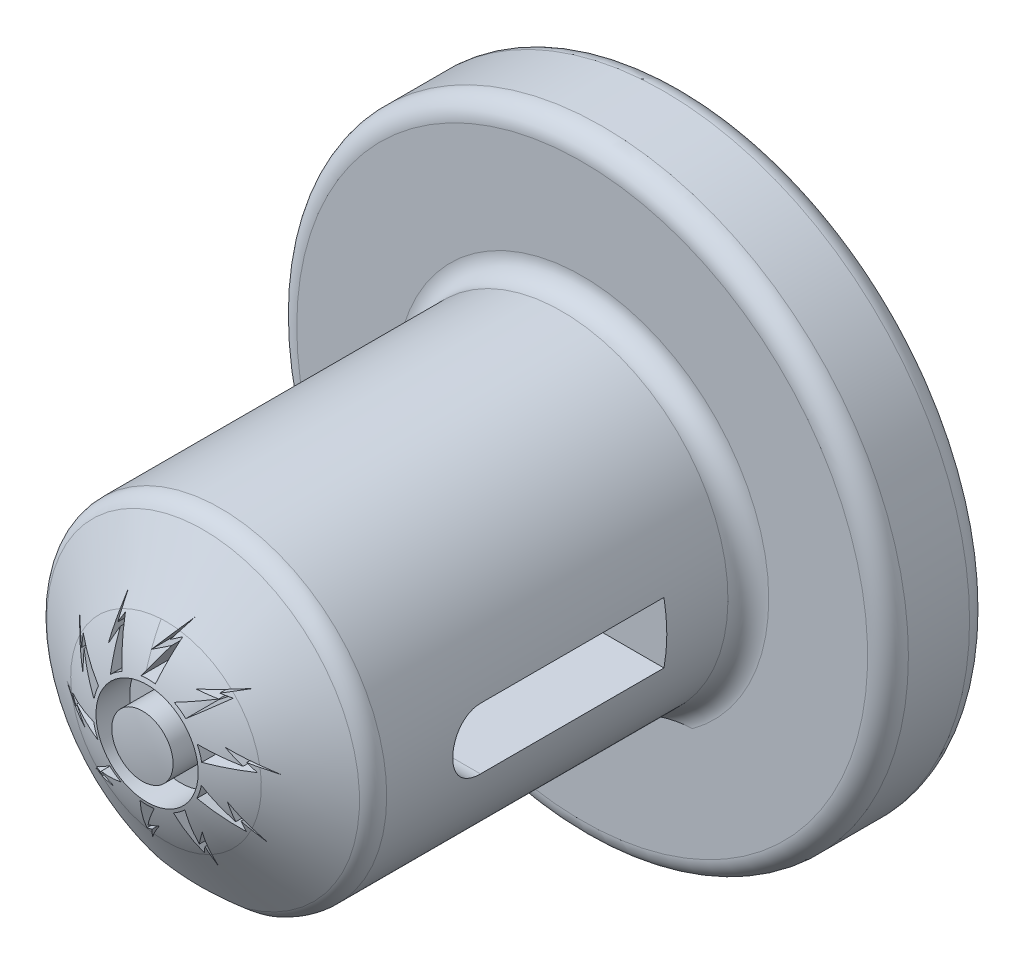
from build123d import *

# Parameters (mm, degrees)
SALIENTE_EXTRUIR1_DEPTH = 23.3
CROQUIS2_R              = 15
SALIENTE_EXTRUIR2_DEPTH = 5
CORTAR_EXTRUIR1_REACH   = 33.51
REDONDEO3_R             = 1
REDONDEO2_R             = 1
CROQUIS5_R              = 2.5
CROQUIS5_R_2            = 1.5
CORTAR_EXTRUIR2_DEPTH   = 2
CHAFL_N1_SIZE           = 0.5
CORTAR_EXTRUIR3_REACH   = 40.406


with BuildPart() as part:
    # Croquis1 → Saliente-Extruir1 (new body)
    with BuildSketch(Plane.XY):
        with BuildLine():
            Line((3.446313308, -7.38548743), (-3.446313308, -7.38548743))
            ThreePointArc((-3.446313308, -7.38548743), (0, 8.15), (3.446313308, -7.38548743))
        make_face()
        with BuildLine():
            Line((2.7, -4.38548743), (-2.7, -4.38548743))
            ThreePointArc((-2.7, -4.38548743), (0, 5.15), (2.7, -4.38548743))
        make_face(mode=Mode.SUBTRACT)
    extrude(amount=SALIENTE_EXTRUIR1_DEPTH)

    # Croquis2 → Saliente-Extruir2 (add)
    with BuildSketch(Plane(origin=(0, 0, 0), x_dir=(-1, 0, 0), z_dir=(0, 0, -1))):
        Circle(CROQUIS2_R)
        with BuildLine():
            Line((2.7, -4.38548743), (-2.7, -4.38548743))
            ThreePointArc((-2.7, -4.38548743), (0, 5.15), (2.7, -4.38548743))
        make_face(mode=Mode.SUBTRACT)
    extrude(amount=-SALIENTE_EXTRUIR2_DEPTH)

    # Croquis3 → Revolución1 (revolve)
    with BuildSketch(Plane(origin=(0, 0, 0), x_dir=(0, 0, -1), z_dir=(1, 0, 0))):
        with BuildLine():
            Line((-23.3, 0), (-23.3, 8.15))
            Line((-23.3, 8.15), (-25.412424531, 4.675672007))
            ThreePointArc((-25.412424531, 4.675672007), (-26.388642769, 2.427842124), (-26.72229506, 0))
            Line((-26.72229506, 0), (-23.3, 0))
        make_face()
    revolve(axis=Axis((0, 0, 26.72229506), (0, 0, -1)))

    # Croquis4 → Cortar-Extruir1 (cut, up to next)
    with BuildSketch(Plane(origin=(0, 0, 23.3), x_dir=(-1, 0, 0), z_dir=(0, 0, -1)), mode=Mode.PRIVATE) as cortar_extruir1_sk1:
        with BuildLine():
            Line((3.446313308, -7.38548743), (-3.446313308, -7.38548743))
            ThreePointArc((-3.446313308, -7.38548743), (0, -8.15), (3.446313308, -7.38548743))
        make_face()
    cortar_extruir1_tool1 = extrude(cortar_extruir1_sk1.sketch, amount=-CORTAR_EXTRUIR1_REACH, mode=Mode.PRIVATE) & part.part
    add(cortar_extruir1_tool1.solids().sort_by_distance((0, -7.692556, 23.3))[0], mode=Mode.SUBTRACT)

    # Redondeo3
    redondeo3_edges = [part.edges().sort_by_distance(p)[0] for p in [
        (15, 0, 0),
        (15, 0, 5),
        (0, 8.15, 5),
        (-7.956576605, 1.76504638, 23.3),
    ]]
    fillet(redondeo3_edges, radius=REDONDEO3_R)

    # Redondeo2
    redondeo2_edges = [part.edges().sort_by_distance(p)[0] for p in [
        (0, -4.38548743, 0),
        (0, 5.15, 0),
    ]]
    fillet(redondeo2_edges, radius=REDONDEO2_R)

    # Croquis5 → Cortar-Extruir2 (cut)
    # profile 1 of 11: a face of its own
    with BuildSketch(Plane.XY.offset(26.72229506)):
        with Locations((0.025979011, -0.015198441)):
            Circle(CROQUIS5_R)
        with Locations((0.025979011, -0.015198441)):
            Circle(CROQUIS5_R_2, mode=Mode.SUBTRACT)
    # profile 2 of 11: a face of its own
    with BuildSketch(Plane.XY.offset(26.72229506)):
        with BuildLine():
            Line((1.302557766, 2.344074393), (2.881616708, 2.973814702))
            Line((2.881616708, 2.973814702), (1.998734761, 3.074340177))
            Line((1.998734761, 3.074340177), (3.892874702, 3.589350961))
            Line((3.892874702, 3.589350961), (2.860263918, 3.177538192))
            Line((2.860263918, 3.177538192), (3.350806324, 3.121684736))
            Line((3.350806324, 3.121684736), (1.868869662, 1.932624716))
            ThreePointArc((1.868869662, 1.932624716), (1.599104223, 2.156780008), (1.302557766, 2.344074393))
        make_face()
    # profile 3 of 11: a face of its own
    with BuildSketch(Plane.XY.offset(26.72229506)):
        with BuildLine():
            Line((-0.324020989, 2.662020265), (0.583312464, 4.099638436))
            Line((0.583312464, 4.099638436), (-0.190041428, 3.662020265))
            Line((-0.190041428, 3.662020265), (1.039634231, 5.192020265))
            Line((1.039634231, 5.192020265), (0.44629203, 4.251903346))
            Line((0.44629203, 4.251903346), (0.875979011, 4.495050543))
            Line((0.875979011, 4.495050543), (0.375979011, 2.662020265))
            ThreePointArc((0.375979011, 2.662020265), (0.025979011, 2.684801559), (-0.324020989, 2.662020265))
        make_face()
    # profile 4 of 11: a face of its own
    with BuildSketch(Plane.XY.offset(26.72229506)):
        with BuildLine():
            Line((2.431603727, 1.130771774), (4.079241313, 0.712094828))
            Line((4.079241313, 0.712094828), (3.424062205, 1.312366634))
            Line((3.424062205, 1.312366634), (5.259169351, 0.615671587))
            Line((5.259169351, 0.615671587), (4.181712206, 0.889461449))
            Line((4.181712206, 0.889461449), (4.545739511, 0.555941462))
            Line((4.545739511, 0.555941462), (2.647915623, 0.465032213))
            ThreePointArc((2.647915623, 0.465032213), (2.561425973, 0.804941801), (2.431603727, 1.130771774))
        make_face()
    # profile 5 of 11: a face of its own
    with BuildSketch(Plane.XY.offset(26.72229506)):
        with BuildLine():
            Line((2.631859712, -0.514447228), (3.718734384, -1.821621067))
            Line((3.718734384, -1.821621067), (3.541514267, -0.950886357))
            Line((3.541514267, -0.950886357), (4.61664006, -2.593173407))
            Line((4.61664006, -2.593173407), (3.905888563, -1.738359335))
            Line((3.905888563, -1.738359335), (4.004354709, -2.222152555))
            Line((4.004354709, -2.222152555), (2.415547816, -1.180186789))
            ThreePointArc((2.415547816, -1.180186789), (2.545370062, -0.854356816), (2.631859712, -0.514447228))
        make_face()
    # profile 6 of 11: a face of its own
    with BuildSketch(Plane.XY.offset(26.72229506)):
        with BuildLine():
            Line((1.82683474, -1.963164875), (1.937797316, -3.659539629))
            Line((1.937797316, -3.659539629), (2.30622825, -2.85093308))
            Line((2.30622825, -2.85093308), (2.210711181, -4.811514298))
            Line((2.210711181, -4.811514298), (2.138148245, -3.702185939))
            Line((2.138148245, -3.702185939), (1.933442511, -4.151459824))
            Line((1.933442511, -4.151459824), (1.260522844, -2.374614551))
            ThreePointArc((1.260522844, -2.374614551), (1.5570693, -2.187320167), (1.82683474, -1.963164875))
        make_face()
    # profile 7 of 11: a face of its own
    with BuildSketch(Plane.XY.offset(26.72229506)):
        with BuildLine():
            Line((0.324020989, -2.662020265), (-0.583312464, -4.099638436))
            Line((-0.583312464, -4.099638436), (0.190041428, -3.662020265))
            Line((0.190041428, -3.662020265), (-1.039634231, -5.192020265))
            Line((-1.039634231, -5.192020265), (-0.44629203, -4.251903346))
            Line((-0.44629203, -4.251903346), (-0.875979011, -4.495050543))
            Line((-0.875979011, -4.495050543), (-0.375979011, -2.662020265))
            ThreePointArc((-0.375979011, -2.662020265), (-0.025979011, -2.684801559), (0.324020989, -2.662020265))
        make_face()
    # profile 8 of 11: a face of its own
    with BuildSketch(Plane.XY.offset(26.72229506)):
        with BuildLine():
            Line((-1.302557766, -2.344074393), (-2.881616708, -2.973814702))
            Line((-2.881616708, -2.973814702), (-1.998734761, -3.074340177))
            Line((-1.998734761, -3.074340177), (-3.892874702, -3.589350961))
            Line((-3.892874702, -3.589350961), (-2.860263918, -3.177538192))
            Line((-2.860263918, -3.177538192), (-3.350806324, -3.121684736))
            Line((-3.350806324, -3.121684736), (-1.868869662, -1.932624716))
            ThreePointArc((-1.868869662, -1.932624716), (-1.599104223, -2.156780008), (-1.302557766, -2.344074393))
        make_face()
    # profile 9 of 11: a face of its own
    with BuildSketch(Plane.XY.offset(26.72229506)):
        with BuildLine():
            Line((-2.431603727, -1.130771774), (-4.079241313, -0.712094828))
            Line((-4.079241313, -0.712094828), (-3.424062205, -1.312366634))
            Line((-3.424062205, -1.312366634), (-5.259169351, -0.615671587))
            Line((-5.259169351, -0.615671587), (-4.181712206, -0.889461449))
            Line((-4.181712206, -0.889461449), (-4.545739511, -0.555941462))
            Line((-4.545739511, -0.555941462), (-2.647915623, -0.465032213))
            ThreePointArc((-2.647915623, -0.465032213), (-2.561425973, -0.804941801), (-2.431603727, -1.130771774))
        make_face()
    # profile 10 of 11: a face of its own
    with BuildSketch(Plane.XY.offset(26.72229506)):
        with BuildLine():
            Line((-2.631859712, 0.514447228), (-3.718734384, 1.821621067))
            Line((-3.718734384, 1.821621067), (-3.541514267, 0.950886357))
            Line((-3.541514267, 0.950886357), (-4.61664006, 2.593173407))
            Line((-4.61664006, 2.593173407), (-3.905888563, 1.738359335))
            Line((-3.905888563, 1.738359335), (-4.004354709, 2.222152555))
            Line((-4.004354709, 2.222152555), (-2.415547816, 1.180186789))
            ThreePointArc((-2.415547816, 1.180186789), (-2.545370062, 0.854356816), (-2.631859712, 0.514447228))
        make_face()
    # profile 11 of 11: a face of its own
    with BuildSketch(Plane.XY.offset(26.72229506)):
        with BuildLine():
            Line((-1.82683474, 1.963164875), (-1.937797316, 3.659539629))
            Line((-1.937797316, 3.659539629), (-2.30622825, 2.85093308))
            Line((-2.30622825, 2.85093308), (-2.210711181, 4.811514298))
            Line((-2.210711181, 4.811514298), (-2.138148245, 3.702185939))
            Line((-2.138148245, 3.702185939), (-1.933442511, 4.151459824))
            Line((-1.933442511, 4.151459824), (-1.260522844, 2.374614551))
            ThreePointArc((-1.260522844, 2.374614551), (-1.5570693, 2.187320167), (-1.82683474, 1.963164875))
        make_face()
    extrude(amount=-CORTAR_EXTRUIR2_DEPTH, mode=Mode.SUBTRACT)

    # Chaflán1
    chafl_n1_edges = [part.edges().sort_by_distance(p)[0] for p in [
        (0, 5.15, 23.3),
    ]]
    chamfer(chafl_n1_edges, length=CHAFL_N1_SIZE)

    # Croquis6 → Cortar-Extruir3 (cut, up to next)
    with BuildSketch(Plane(origin=(8.15, 0, 0), x_dir=(0, 0, -1), z_dir=(1, 0, 0)), mode=Mode.PRIVATE) as cortar_extruir3_sk1:
        with BuildLine():
            Line((-9, -1.5), (-9, 1.5))
            Line((-9, 1.5), (-18, 1.5))
            ThreePointArc((-18, 1.5), (-19.5, 0), (-18, -1.5))
            Line((-18, -1.5), (-9, -1.5))
        make_face()
    cortar_extruir3_tool1 = extrude(cortar_extruir3_sk1.sketch, amount=-CORTAR_EXTRUIR3_REACH, mode=Mode.PRIVATE) & part.part
    add(cortar_extruir3_tool1.solids().sort_by_distance((8.15, 0, 14.094555))[0], mode=Mode.SUBTRACT)


solid = part.part
